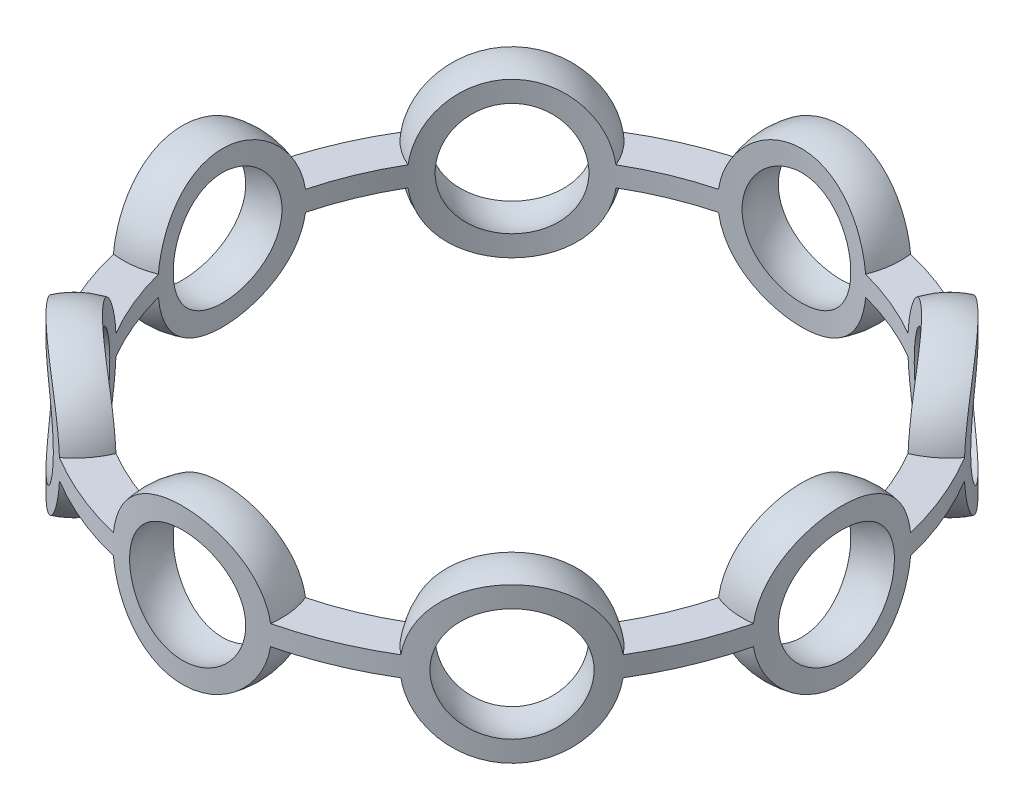
from build123d import *
from build123d.topology import SkipClean

# Parameters (mm, degrees)
BOSS_EXTRUDE1_DEPTH      = 0.5
BOSS_EXTRUDE1_DEPTH_BACK = 0.5
SKETCH1_R                = 16.5
SKETCH1_R_2              = 14.5
CIRPATTERN1_COUNT        = 8
CUT_EXTRUDE1_DEPTH       = 20
CUT_EXTRUDE1_DEPTH_BACK  = 20
SKETCH5_R                = 14.5
CUT_EXTRUDE2_DEPTH       = 20
CUT_EXTRUDE2_DEPTH_BACK  = 20
SKETCH5_3_R              = 22.365395618
SKETCH5_3_R_2            = 16.5
CIRPATTERN2_COUNT        = 8


with BuildPart() as part:
    # Sketch1 → Boss-Extrude1 (new, two sides: drawn at the far end of the back side and taken through both)
    with BuildSketch(Plane(origin=(0, 0, 0), x_dir=(1, 0, 0), z_dir=(0, 1, 0)).offset(-BOSS_EXTRUDE1_DEPTH_BACK)):
        with Locations(Location((0, 0, 0), (0, 0, 270))):
            Circle(SKETCH1_R)
        with Locations(Location((0, 0, 0), (0, 0, 270))):
            Circle(SKETCH1_R_2, mode=Mode.SUBTRACT)
    extrude(amount=BOSS_EXTRUDE1_DEPTH + BOSS_EXTRUDE1_DEPTH_BACK)

    # Sketch2 → Cut-Revolve1 (revolve, cut)
    with BuildSketch(Plane.XY):
        with BuildLine():
            ThreePointArc((-18.5, 0), (-15.5, 3), (-12.5, 0))
            Line((-12.5, 0), (-18.5, 0))
        make_face()
    cut_revolve1 = revolve(axis=Axis((-0.517271989, 0, 0), (-1, 0, 0)), mode=Mode.SUBTRACT)

    # Sketch2<3> → Revolve1 (revolve)
    with BuildSketch(Plane.XY):
        with BuildLine():
            Line((-19.5, 0), (-18.5, 0))
            ThreePointArc((-18.5, 0), (-15.5, 3), (-12.5, 0))
            Line((-12.5, 0), (-11.5, 0))
            ThreePointArc((-11.5, 0), (-15.5, 4), (-19.5, 0))
        make_face()
    revolve1 = revolve(axis=Axis((-0.517271989, 0, 0), (-1, 0, 0)))

    # CirPattern1: Revolve1 ×8 about axis
    cirpattern1_axis = Axis((0, 0, 0), (0, 1, 0))
    for i in range(1, CIRPATTERN1_COUNT):
        add(revolve1.rotate(cirpattern1_axis, i * 360 / CIRPATTERN1_COUNT))

    # Sketch5 → Cut-Extrude1 (cut, two sides: drawn at the far end of the back side and taken through both)
    with SkipClean():  # the faces are left unmerged after this step: merging them gives an invalid solid
        with BuildSketch(Plane(origin=(0, 0, 0), x_dir=(1, 0, 0), z_dir=(0, 1, 0)).offset(-CUT_EXTRUDE1_DEPTH_BACK)):
            with Locations(Location((0, 0, 0), (0, 0, 284.718501248))):
                Circle(SKETCH5_R)
        extrude(amount=CUT_EXTRUDE1_DEPTH + CUT_EXTRUDE1_DEPTH_BACK, mode=Mode.SUBTRACT)

    # Sketch5<3> → Cut-Extrude2 (cut, two sides: drawn at the far end of the back side and taken through both)
    with BuildSketch(Plane(origin=(0, 0, 0), x_dir=(1, 0, 0), z_dir=(0, 1, 0)).offset(-CUT_EXTRUDE2_DEPTH_BACK)):
        Circle(SKETCH5_3_R)
        with Locations(Location((0, 0, 0), (0, 0, 283.793040774))):
            Circle(SKETCH5_3_R_2, mode=Mode.SUBTRACT)
    extrude(amount=CUT_EXTRUDE2_DEPTH + CUT_EXTRUDE2_DEPTH_BACK, mode=Mode.SUBTRACT)

    # CirPattern2: Cut-Revolve1 ×8 about axis
    cirpattern2_axis = Axis((0, 0, 0), (0, 1, 0))
    for i in range(1, CIRPATTERN2_COUNT):
        add(cut_revolve1.rotate(cirpattern2_axis, i * 360 / CIRPATTERN2_COUNT), mode=Mode.SUBTRACT)


solid = part.part
